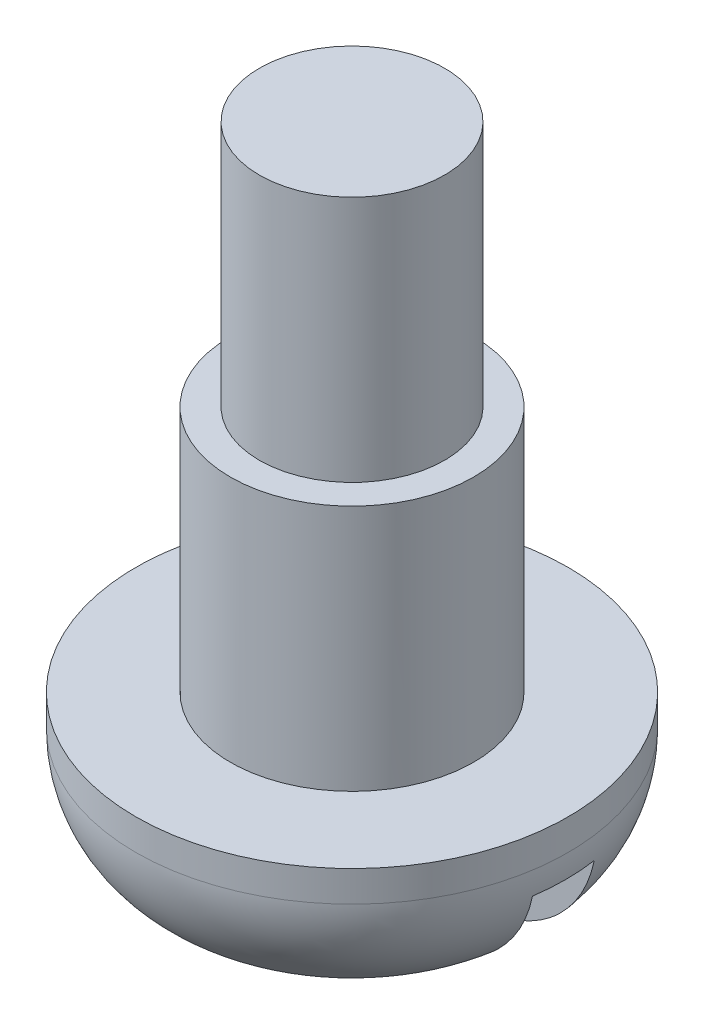
from build123d import *

# Parameters (mm, degrees)
SCHIZZO1_R                   = 1.97
ESTRUSIONE_ESTRUSIONE1_DEPTH = 4
SCHIZZO2_R                   = 1.5
ESTRUSIONE_ESTRUSIONE2_DEPTH = 4
SCHIZZO3_R                   = 3.5
ESTRUSIONE_ESTRUSIONE3_DEPTH = 2.5
RACCORDO1_R                  = 2
SCHIZZO4_W                   = 1
SCHIZZO4_H                   = 1
TAGLIO_ESTRUSIONE1_DEPTH     = 3
SCHIZZO5_W                   = 7
SCHIZZO5_H                   = 1
TAGLIO_ESTRUSIONE2_DEPTH     = 1.6
RACCORDO2_R                  = 2


with BuildPart() as part:
    # Schizzo1 → Estrusione-Estrusione1 (new body)
    with BuildSketch(Plane(origin=(0, 0, 0), x_dir=(1, 0, 0), z_dir=(0, 1, 0))):
        with Locations(Location((0, 0, 0), (0, 0, 270))):
            Circle(SCHIZZO1_R)
    extrude(amount=ESTRUSIONE_ESTRUSIONE1_DEPTH)

    # Schizzo2 → Estrusione-Estrusione2 (add)
    with BuildSketch(Plane(origin=(0, 4, 0), x_dir=(1, 0, 0), z_dir=(0, 1, 0))):
        with Locations(Location((0, 0, 0), (0, 0, 270))):
            Circle(SCHIZZO2_R)
    extrude(amount=ESTRUSIONE_ESTRUSIONE2_DEPTH)

    # Schizzo3 → Estrusione-Estrusione3 (add)
    with BuildSketch(Plane(origin=(0, 0, 0), x_dir=(-1, 0, 0), z_dir=(0, -1, 0))):
        with Locations(Location((0, 0, 0), (0, 0, 90))):
            Circle(SCHIZZO3_R)
    extrude(amount=ESTRUSIONE_ESTRUSIONE3_DEPTH)

    # Raccordo1
    raccordo1_edges = [part.edges().sort_by_distance(p)[0] for p in [
        (0, -2.5, 3.5),
    ]]
    fillet(raccordo1_edges, radius=RACCORDO1_R)

    # Schizzo4 → Taglio-Estrusione1 (cut)
    with BuildSketch(Plane.XZ.offset(2.5)):
        with BuildLine():
            Line((-0.5, 1.414213562), (-0.5, 0.5))
            Line((-0.5, 0.5), (0.5, 0.5))
            Line((0.5, 0.5), (0.5, 1.414213562))
            ThreePointArc((0.5, 1.414213562), (0, 1.5), (-0.5, 1.414213562))
        make_face()
        Rectangle(SCHIZZO4_W, SCHIZZO4_H)
        with BuildLine():
            Line((-0.5, 1.775), (-0.5, 1.414213562))
            ThreePointArc((-0.5, 1.414213562), (0, 1.5), (0.5, 1.414213562))
            Line((0.5, 1.414213562), (0.5, 1.775))
            Line((0.5, 1.775), (-0.5, 1.775))
        make_face()
        with BuildLine():
            Line((-1.414213562, -0.5), (-0.5, -0.5))
            Line((-0.5, -0.5), (-0.5, 0.5))
            Line((-0.5, 0.5), (-1.414213562, 0.5))
            ThreePointArc((-1.414213562, 0.5), (-1.5, 0), (-1.414213562, -0.5))
        make_face()
        with BuildLine():
            Line((-1.775, -0.5), (-1.414213562, -0.5))
            ThreePointArc((-1.414213562, -0.5), (-1.5, 0), (-1.414213562, 0.5))
            Line((-1.414213562, 0.5), (-1.775, 0.5))
            Line((-1.775, 0.5), (-1.775, -0.5))
        make_face()
        with BuildLine():
            Line((-0.5, -0.5), (-0.5, -1.414213562))
            ThreePointArc((-0.5, -1.414213562), (0, -1.5), (0.5, -1.414213562))
            Line((0.5, -1.414213562), (0.5, -0.5))
            Line((0.5, -0.5), (-0.5, -0.5))
        make_face()
        with BuildLine():
            Line((-0.5, -1.414213562), (-0.5, -1.775))
            Line((-0.5, -1.775), (0.5, -1.775))
            Line((0.5, -1.775), (0.5, -1.414213562))
            ThreePointArc((0.5, -1.414213562), (0, -1.5), (-0.5, -1.414213562))
        make_face()
        with BuildLine():
            Line((0.5, 0.5), (0.5, -0.5))
            Line((0.5, -0.5), (1.414213562, -0.5))
            ThreePointArc((1.414213562, -0.5), (1.478397839, -0.253652968), (1.5, 0))
            ThreePointArc((1.5, 0), (1.478397839, 0.253652968), (1.414213562, 0.5))
            Line((1.414213562, 0.5), (0.5, 0.5))
        make_face()
        with BuildLine():
            ThreePointArc((1.5, 0), (1.478397839, -0.253652968), (1.414213562, -0.5))
            Line((1.414213562, -0.5), (1.775, -0.5))
            Line((1.775, -0.5), (1.775, 0.5))
            Line((1.775, 0.5), (1.414213562, 0.5))
            ThreePointArc((1.414213562, 0.5), (1.478397839, 0.253652968), (1.5, 0))
        make_face()
    extrude(amount=-TAGLIO_ESTRUSIONE1_DEPTH, mode=Mode.SUBTRACT)

    # Schizzo5 → Taglio-Estrusione2 (cut)
    with BuildSketch(Plane(origin=(0, -2.5, 0), x_dir=(-1, 0, 0), z_dir=(0, -1, 0))):
        Rectangle(SCHIZZO5_W, SCHIZZO5_H)
    extrude(amount=-TAGLIO_ESTRUSIONE2_DEPTH, mode=Mode.SUBTRACT)

    # Raccordo2
    # the kernel refuses this fillet: 2 mm, written as the material it adds along each edge
    with BuildSketch(Plane(origin=(1.775, 0.5, -5.269696007), x_dir=(-1, 0, 0), z_dir=(0, 0, 1))) as raccordo2_piece_1_section:
        with BuildLine():
            CenterArc((1.907878403, 2), RACCORDO2_R, 197.457603124, 72.542396876)
            Line((0, 1.4), (0, 0))
            Line((0, 0), (1.907878403, 0))
        make_face()
    raccordo2_piece_1 = extrude(amount=10.539392014, mode=Mode.PRIVATE)
    raccordo2_piece_1 = raccordo2_piece_1 & Plane(origin=(0, 0.47808748, 0), x_dir=(0, 0, 1), z_dir=(0, -1, 0)) * Cylinder(1.97, 29, mode=Mode.PRIVATE)
    add(raccordo2_piece_1)
    with BuildSketch(Plane(origin=(-1.775, 0.5, 5.269696007), x_dir=(1, 0, 0), z_dir=(0, 0, -1))) as raccordo2_piece_2_section:
        with BuildLine():
            CenterArc((1.907878403, 2), RACCORDO2_R, 197.457603124, 72.542396876)
            Line((0, 1.4), (0, 0))
            Line((0, 0), (1.907878403, 0))
        make_face()
    raccordo2_piece_2 = extrude(amount=10.539392014, mode=Mode.PRIVATE)
    raccordo2_piece_2 = raccordo2_piece_2 & Plane(origin=(0, 0.47808748, 0), x_dir=(0, 0, 1), z_dir=(0, -1, 0)) * Cylinder(1.97, 29, mode=Mode.PRIVATE)
    add(raccordo2_piece_2)


solid = part.part
